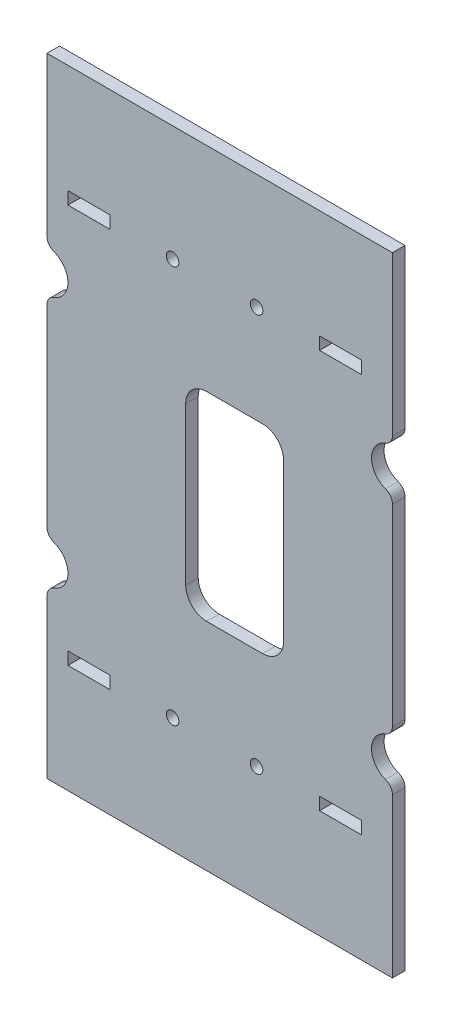
from build123d import *

# Parameters (mm, degrees)
SALIENTE_EXTRUIR1_START = -1.5
SALIENTE_EXTRUIR1_DEPTH = 3
CROQUIS4_W              = 23.371648172
CROQUIS4_H              = 47.52448784
CORTAR_EXTRUIR3_DEPTH   = 10
CROQUIS5_W              = 9.999999994
CROQUIS5_H              = 3
CROQUIS5_W_2            = 9.999999993
CORTAR_EXTRUIR4_DEPTH   = 10
CROQUIS6_R              = 1.5
CORTAR_EXTRUIR5_DEPTH   = 10
REDONDEO1_R             = 5


# Read off the part's stored shape, not the designer's step: Saliente-Extruir1
with BuildPart() as part:
    # Saliente-Extruir1 outline → Saliente-Extruir1 (new body)
    with BuildSketch(Plane.XY.offset(SALIENTE_EXTRUIR1_START)):
        with BuildLine():
            ThreePointArc((492.916449572, 98.009593947), (492.452410006, 99.442022929), (491.249851225, 100.348134338))
            ThreePointArc((491.249851225, 100.348134338), (487.916517891, 105.062179546), (491.249851225, 109.776224754))
            ThreePointArc((491.249851225, 109.776224754), (492.452037009, 110.681812922), (492.916439741, 112.113480025))
            Line((492.916439741, 112.113480025), (492.916413331, 149.999679341))
            Line((492.916413331, 149.999679341), (410.416517891, 149.999679341))
            Line((410.416517891, 149.999679341), (410.416517891, 112.133247358))
            ThreePointArc((410.416517891, 112.133247358), (410.875276439, 110.689871685), (412.083184558, 109.776224754))
            ThreePointArc((412.083184558, 109.776224754), (415.416517891, 105.062179546), (412.083184558, 100.348134338))
            ThreePointArc((412.083184558, 100.348134338), (410.875276439, 99.434487407), (410.416517891, 97.991111734))
            Line((410.416517891, 97.991111734), (410.416517891, 52.008362374))
            ThreePointArc((410.416517891, 52.008362374), (410.875276439, 50.564986701), (412.083184558, 49.65133977))
            ThreePointArc((412.083184558, 49.65133977), (415.416517891, 44.937294562), (412.083184558, 40.223249354))
            ThreePointArc((412.083184558, 40.223249354), (410.875276439, 39.309602423), (410.416517891, 37.86622675))
            Line((410.416517891, 37.86622675), (410.416517891, -0.000320659))
            Line((410.416517891, -0.000320659), (492.916517891, -0.000320659))
            Line((492.916517891, -0.000320659), (492.916491488, 37.877716604))
            ThreePointArc((492.916491488, 37.877716604), (492.45443711, 39.314289338), (491.249851225, 40.223249354))
            ThreePointArc((491.249851225, 40.223249354), (487.916517891, 44.937294562), (491.249851225, 49.65133977))
            ThreePointArc((491.249851225, 49.65133977), (492.453865854, 50.559496169), (492.916481647, 51.994900607))
            Line((492.916481647, 51.994900607), (492.916449572, 98.009593947))
        make_face()
    extrude(amount=SALIENTE_EXTRUIR1_DEPTH)

    # Croquis4 → Cortar-Extruir3 (cut)
    with BuildSketch(Plane.XY.offset(1.5)):
        with Locations((455.222459901, 75.336681949)):
            Rectangle(CROQUIS4_W, CROQUIS4_H)
    extrude(amount=-CORTAR_EXTRUIR3_DEPTH, mode=Mode.SUBTRACT)

    # Croquis5 → Cortar-Extruir4 (cut)
    with BuildSketch(Plane(origin=(0, 0, -1.5), x_dir=(-1, 0, 0), z_dir=(0, 0, -1))):
        with Locations((-420.416517885, 27.399679341)):
            Rectangle(CROQUIS5_W, CROQUIS5_H)
        with Locations((-480.50829052, 27.399679341)):
            Rectangle(CROQUIS5_W_2, CROQUIS5_H)
        with Locations((-480.50829052, 122.599679342)):
            Rectangle(CROQUIS5_W_2, CROQUIS5_H)
        with Locations((-420.416517885, 122.599679342)):
            Rectangle(CROQUIS5_W, CROQUIS5_H)
    extrude(amount=-CORTAR_EXTRUIR4_DEPTH, mode=Mode.SUBTRACT)

    # Croquis6 → Cortar-Extruir5 (cut)
    with BuildSketch(Plane.XY.offset(1.5)):
        with Locations((460.461664074, 27.503843939)):
            Circle(CROQUIS6_R)
        with Locations((440.404261852, 27.568711017)):
            Circle(CROQUIS6_R)
        with Locations((440.404261852, 122.435783537)):
            Circle(CROQUIS6_R)
        with Locations((460.461664074, 122.500650615)):
            Circle(CROQUIS6_R)
    extrude(amount=-CORTAR_EXTRUIR5_DEPTH, mode=Mode.SUBTRACT)

    # Redondeo1
    redondeo1_edges = [part.edges().sort_by_distance(p)[0] for p in [
        (466.908283987, 99.098925869, 0),
        (466.908283987, 51.574438029, 0),
        (443.536635815, 51.574438029, 0),
        (443.536635815, 99.098925869, 0),
    ]]
    fillet(redondeo1_edges, radius=REDONDEO1_R)


solid = part.part
